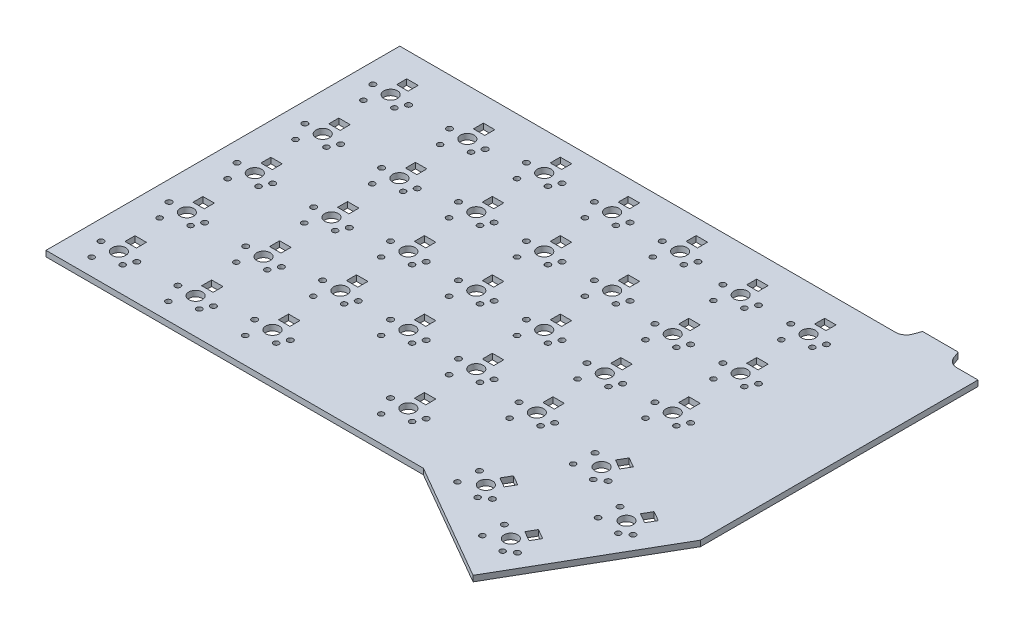
from build123d import *

# Parameters (mm, degrees)
SKETCH4_R           = 0.76
SKETCH4_R_2         = 1.9
SKETCH4_R_3         = 0.800000002
SKETCH4_R_4         = 0.8
SKETCH4_W           = 3.2
SKETCH4_H           = 2.8
BOSS_EXTRUDE1_DEPTH = 1.6
EXTRUDE_THIN1_START = -1.6
EXTRUDE_THIN1_DEPTH = 1.6


# Read off the part's stored shape, not the designer's step: Extrude-Thin1
with BuildPart() as part:
    # Sketch4 → Boss-Extrude1 (new body)
    with BuildSketch(Plane(origin=(0, 0, 0), x_dir=(1, 0, 0), z_dir=(0, 1, 0))):
        Polygon((162.15, -77.8), (162.15, 0), (0, 0), (0, -99.2), (105.815887282, -99.2), (138.8, -118.243386357), align=None)
        with Locations(Location((35.75, -15.759725685, 0), (0, 0, 270))):
            Circle(SKETCH4_R, mode=Mode.SUBTRACT)
        with Locations(Location((32.02, -13.07, 0), (0, 0, 270))):
            Circle(SKETCH4_R_2, mode=Mode.SUBTRACT)
        with Locations(Location((29.56, -18.25021243, 0), (0, 0, 270))):
            Circle(SKETCH4_R, mode=Mode.SUBTRACT)
        with Locations(Location((37.02, -13.07, 0), (0, 0, 270))):
            Circle(SKETCH4_R_3, mode=Mode.SUBTRACT)
        with Locations(Location((27.02, -13.07, 0), (0, 0, 270))):
            Circle(SKETCH4_R_4, mode=Mode.SUBTRACT)
        with Locations(Location((54.8, -13.251745606, 0), (0, 0, 270))):
            Circle(SKETCH4_R, mode=Mode.SUBTRACT)
        with Locations(Location((5.52, -13.07, 0), (0, 0, 270))):
            Circle(SKETCH4_R_4, mode=Mode.SUBTRACT)
        with Locations(Location((51.07, -10.562019921, 0), (0, 0, 270))):
            Circle(SKETCH4_R_2, mode=Mode.SUBTRACT)
        with Locations(Location((15.52, -13.07, 0), (0, 0, 270))):
            Circle(SKETCH4_R_3, mode=Mode.SUBTRACT)
        with Locations(Location((48.61, -15.742232351, 0), (0, 0, 270))):
            Circle(SKETCH4_R, mode=Mode.SUBTRACT)
        with Locations(Location((14.25, -15.759725685, 0), (0, 0, 270))):
            Circle(SKETCH4_R, mode=Mode.SUBTRACT)
        with Locations(Location((8.06, -18.25021243, 0), (0, 0, 270))):
            Circle(SKETCH4_R, mode=Mode.SUBTRACT)
        with Locations(Location((56.07, -10.562019921, 0), (0, 0, 270))):
            Circle(SKETCH4_R_3, mode=Mode.SUBTRACT)
        with Locations(Location((10.52, -13.07, 0), (0, 0, 270))):
            Circle(SKETCH4_R_2, mode=Mode.SUBTRACT)
        with Locations(Location((46.07, -10.562019921, 0), (0, 0, 270))):
            Circle(SKETCH4_R_4, mode=Mode.SUBTRACT)
        with Locations(Location((73.850000001, -13.251745606, 0), (0, 0, 270))):
            Circle(SKETCH4_R, mode=Mode.SUBTRACT)
        with Locations(Location((70.120000001, -10.562019921, 0), (0, 0, 270))):
            Circle(SKETCH4_R_2, mode=Mode.SUBTRACT)
        with Locations(Location((67.660000001, -15.742232351, 0), (0, 0, 270))):
            Circle(SKETCH4_R, mode=Mode.SUBTRACT)
        with Locations(Location((75.120000001, -10.562019921, 0), (0, 0, 270))):
            Circle(SKETCH4_R_3, mode=Mode.SUBTRACT)
        with Locations(Location((65.120000001, -10.562019921, 0), (0, 0, 270))):
            Circle(SKETCH4_R_4, mode=Mode.SUBTRACT)
        with Locations(Location((92.9, -13.251745606, 0), (0, 0, 270))):
            Circle(SKETCH4_R, mode=Mode.SUBTRACT)
        with Locations(Location((89.17, -10.562019921, 0), (0, 0, 270))):
            Circle(SKETCH4_R_2, mode=Mode.SUBTRACT)
        with Locations(Location((86.71, -15.742232351, 0), (0, 0, 270))):
            Circle(SKETCH4_R, mode=Mode.SUBTRACT)
        with Locations(Location((94.17, -10.562019921, 0), (0, 0, 270))):
            Circle(SKETCH4_R_3, mode=Mode.SUBTRACT)
        with Locations(Location((84.17, -10.562019921, 0), (0, 0, 270))):
            Circle(SKETCH4_R_4, mode=Mode.SUBTRACT)
        with Locations(Location((111.95, -15.321237867, 0), (0, 0, 270))):
            Circle(SKETCH4_R, mode=Mode.SUBTRACT)
        with Locations(Location((108.22, -12.631512182, 0), (0, 0, 270))):
            Circle(SKETCH4_R_2, mode=Mode.SUBTRACT)
        with Locations(Location((105.76, -17.811724612, 0), (0, 0, 270))):
            Circle(SKETCH4_R, mode=Mode.SUBTRACT)
        with Locations(Location((113.22, -12.631512182, 0), (0, 0, 270))):
            Circle(SKETCH4_R_3, mode=Mode.SUBTRACT)
        with Locations(Location((103.22, -12.631512182, 0), (0, 0, 270))):
            Circle(SKETCH4_R_4, mode=Mode.SUBTRACT)
        with Locations(Location((131, -15.321237867, 0), (0, 0, 270))):
            Circle(SKETCH4_R, mode=Mode.SUBTRACT)
        with Locations(Location((127.27, -12.631512182, 0), (0, 0, 270))):
            Circle(SKETCH4_R_2, mode=Mode.SUBTRACT)
        with Locations(Location((124.81, -17.811724612, 0), (0, 0, 270))):
            Circle(SKETCH4_R, mode=Mode.SUBTRACT)
        with Locations(Location((132.27, -12.631512182, 0), (0, 0, 270))):
            Circle(SKETCH4_R_3, mode=Mode.SUBTRACT)
        with Locations(Location((122.27, -12.631512182, 0), (0, 0, 270))):
            Circle(SKETCH4_R_4, mode=Mode.SUBTRACT)
        with Locations(Location((131, -34.371237867, 0), (0, 0, 270))):
            Circle(SKETCH4_R, mode=Mode.SUBTRACT)
        with Locations(Location((127.27, -31.681512182, 0), (0, 0, 270))):
            Circle(SKETCH4_R_2, mode=Mode.SUBTRACT)
        with Locations(Location((124.81, -36.861724612, 0), (0, 0, 270))):
            Circle(SKETCH4_R, mode=Mode.SUBTRACT)
        with Locations(Location((132.27, -31.681512182, 0), (0, 0, 270))):
            Circle(SKETCH4_R_3, mode=Mode.SUBTRACT)
        with Locations(Location((122.27, -31.681512182, 0), (0, 0, 270))):
            Circle(SKETCH4_R_4, mode=Mode.SUBTRACT)
        with Locations(Location((111.95, -34.371237867, 0), (0, 0, 270))):
            Circle(SKETCH4_R, mode=Mode.SUBTRACT)
        with Locations(Location((108.22, -31.681512182, 0), (0, 0, 270))):
            Circle(SKETCH4_R_2, mode=Mode.SUBTRACT)
        with Locations(Location((105.76, -36.861724612, 0), (0, 0, 270))):
            Circle(SKETCH4_R, mode=Mode.SUBTRACT)
        with Locations(Location((113.22, -31.681512182, 0), (0, 0, 270))):
            Circle(SKETCH4_R_3, mode=Mode.SUBTRACT)
        with Locations(Location((103.22, -31.681512182, 0), (0, 0, 270))):
            Circle(SKETCH4_R_4, mode=Mode.SUBTRACT)
        with Locations(Location((92.902083096, -32.301971902, 0), (0, 0, 270))):
            Circle(SKETCH4_R, mode=Mode.SUBTRACT)
        with Locations(Location((89.172083096, -29.612246218, 0), (0, 0, 270))):
            Circle(SKETCH4_R_2, mode=Mode.SUBTRACT)
        with Locations(Location((86.712083096, -34.792458648, 0), (0, 0, 270))):
            Circle(SKETCH4_R, mode=Mode.SUBTRACT)
        with Locations(Location((94.172083096, -29.612246218, 0), (0, 0, 270))):
            Circle(SKETCH4_R_3, mode=Mode.SUBTRACT)
        with Locations(Location((84.172083096, -29.612246218, 0), (0, 0, 270))):
            Circle(SKETCH4_R_4, mode=Mode.SUBTRACT)
        with Locations(Location((73.852083097, -32.301971902, 0), (0, 0, 270))):
            Circle(SKETCH4_R, mode=Mode.SUBTRACT)
        with Locations(Location((70.122083097, -29.612246218, 0), (0, 0, 270))):
            Circle(SKETCH4_R_2, mode=Mode.SUBTRACT)
        with Locations(Location((67.662083097, -34.792458648, 0), (0, 0, 270))):
            Circle(SKETCH4_R, mode=Mode.SUBTRACT)
        with Locations(Location((75.122083097, -29.612246218, 0), (0, 0, 270))):
            Circle(SKETCH4_R_3, mode=Mode.SUBTRACT)
        with Locations(Location((65.122083097, -29.612246218, 0), (0, 0, 270))):
            Circle(SKETCH4_R_4, mode=Mode.SUBTRACT)
        with Locations(Location((54.802083097, -32.301971902, 0), (0, 0, 270))):
            Circle(SKETCH4_R, mode=Mode.SUBTRACT)
        with Locations(Location((51.072083097, -29.612246218, 0), (0, 0, 270))):
            Circle(SKETCH4_R_2, mode=Mode.SUBTRACT)
        with Locations(Location((48.612083097, -34.792458648, 0), (0, 0, 270))):
            Circle(SKETCH4_R, mode=Mode.SUBTRACT)
        with Locations(Location((56.072083097, -29.612246218, 0), (0, 0, 270))):
            Circle(SKETCH4_R_3, mode=Mode.SUBTRACT)
        with Locations(Location((46.072083097, -29.612246218, 0), (0, 0, 270))):
            Circle(SKETCH4_R_4, mode=Mode.SUBTRACT)
        with Locations(Location((35.752083097, -34.809951982, 0), (0, 0, 270))):
            Circle(SKETCH4_R, mode=Mode.SUBTRACT)
        with Locations(Location((32.022083097, -32.120226297, 0), (0, 0, 270))):
            Circle(SKETCH4_R_2, mode=Mode.SUBTRACT)
        with Locations(Location((29.562083097, -37.300438727, 0), (0, 0, 270))):
            Circle(SKETCH4_R, mode=Mode.SUBTRACT)
        with Locations(Location((37.022083097, -32.120226297, 0), (0, 0, 270))):
            Circle(SKETCH4_R_3, mode=Mode.SUBTRACT)
        with Locations(Location((27.022083097, -32.120226297, 0), (0, 0, 270))):
            Circle(SKETCH4_R_4, mode=Mode.SUBTRACT)
        with Locations(Location((14.252083097, -34.809951982, 0), (0, 0, 270))):
            Circle(SKETCH4_R, mode=Mode.SUBTRACT)
        with Locations(Location((10.522083097, -32.120226297, 0), (0, 0, 270))):
            Circle(SKETCH4_R_2, mode=Mode.SUBTRACT)
        with Locations(Location((8.062083097, -37.300438727, 0), (0, 0, 270))):
            Circle(SKETCH4_R, mode=Mode.SUBTRACT)
        with Locations(Location((15.522083097, -32.120226297, 0), (0, 0, 270))):
            Circle(SKETCH4_R_3, mode=Mode.SUBTRACT)
        with Locations(Location((5.522083097, -32.120226297, 0), (0, 0, 270))):
            Circle(SKETCH4_R_4, mode=Mode.SUBTRACT)
        with Locations(Location((14.252083097, -53.859951982, 0), (0, 0, 270))):
            Circle(SKETCH4_R, mode=Mode.SUBTRACT)
        with Locations(Location((10.522083097, -51.170226297, 0), (0, 0, 270))):
            Circle(SKETCH4_R_2, mode=Mode.SUBTRACT)
        with Locations(Location((8.062083097, -56.350438727, 0), (0, 0, 270))):
            Circle(SKETCH4_R, mode=Mode.SUBTRACT)
        with Locations(Location((15.522083097, -51.170226297, 0), (0, 0, 270))):
            Circle(SKETCH4_R_3, mode=Mode.SUBTRACT)
        with Locations(Location((5.522083097, -51.170226297, 0), (0, 0, 270))):
            Circle(SKETCH4_R_4, mode=Mode.SUBTRACT)
        with Locations(Location((35.752083097, -53.859951982, 0), (0, 0, 270))):
            Circle(SKETCH4_R, mode=Mode.SUBTRACT)
        with Locations(Location((32.022083097, -51.170226297, 0), (0, 0, 270))):
            Circle(SKETCH4_R_2, mode=Mode.SUBTRACT)
        with Locations(Location((29.562083097, -56.350438727, 0), (0, 0, 270))):
            Circle(SKETCH4_R, mode=Mode.SUBTRACT)
        with Locations(Location((37.022083097, -51.170226297, 0), (0, 0, 270))):
            Circle(SKETCH4_R_3, mode=Mode.SUBTRACT)
        with Locations(Location((27.022083097, -51.170226297, 0), (0, 0, 270))):
            Circle(SKETCH4_R_4, mode=Mode.SUBTRACT)
        with Locations(Location((54.802083097, -51.351971902, 0), (0, 0, 270))):
            Circle(SKETCH4_R, mode=Mode.SUBTRACT)
        with Locations(Location((51.072083097, -48.662246218, 0), (0, 0, 270))):
            Circle(SKETCH4_R_2, mode=Mode.SUBTRACT)
        with Locations(Location((48.612083097, -53.842458648, 0), (0, 0, 270))):
            Circle(SKETCH4_R, mode=Mode.SUBTRACT)
        with Locations(Location((56.072083097, -48.662246218, 0), (0, 0, 270))):
            Circle(SKETCH4_R_3, mode=Mode.SUBTRACT)
        with Locations(Location((46.072083097, -48.662246218, 0), (0, 0, 270))):
            Circle(SKETCH4_R_4, mode=Mode.SUBTRACT)
        with Locations(Location((73.852083098, -51.351971902, 0), (0, 0, 270))):
            Circle(SKETCH4_R, mode=Mode.SUBTRACT)
        with Locations(Location((70.122083098, -48.662246218, 0), (0, 0, 270))):
            Circle(SKETCH4_R_2, mode=Mode.SUBTRACT)
        with Locations(Location((67.662083098, -53.842458648, 0), (0, 0, 270))):
            Circle(SKETCH4_R, mode=Mode.SUBTRACT)
        with Locations(Location((75.122083098, -48.662246218, 0), (0, 0, 270))):
            Circle(SKETCH4_R_3, mode=Mode.SUBTRACT)
        with Locations(Location((65.122083098, -48.662246218, 0), (0, 0, 270))):
            Circle(SKETCH4_R_4, mode=Mode.SUBTRACT)
        with Locations(Location((92.902083097, -51.351971902, 0), (0, 0, 270))):
            Circle(SKETCH4_R, mode=Mode.SUBTRACT)
        with Locations(Location((89.172083097, -48.662246218, 0), (0, 0, 270))):
            Circle(SKETCH4_R_2, mode=Mode.SUBTRACT)
        with Locations(Location((86.712083097, -53.842458648, 0), (0, 0, 270))):
            Circle(SKETCH4_R, mode=Mode.SUBTRACT)
        with Locations(Location((94.172083097, -48.662246218, 0), (0, 0, 270))):
            Circle(SKETCH4_R_3, mode=Mode.SUBTRACT)
        with Locations(Location((84.172083097, -48.662246218, 0), (0, 0, 270))):
            Circle(SKETCH4_R_4, mode=Mode.SUBTRACT)
        with Locations(Location((111.952083097, -53.421464163, 0), (0, 0, 270))):
            Circle(SKETCH4_R, mode=Mode.SUBTRACT)
        with Locations(Location((108.222083097, -50.731738479, 0), (0, 0, 270))):
            Circle(SKETCH4_R_2, mode=Mode.SUBTRACT)
        with Locations(Location((105.762083097, -55.911950909, 0), (0, 0, 270))):
            Circle(SKETCH4_R, mode=Mode.SUBTRACT)
        with Locations(Location((113.222083097, -50.731738479, 0), (0, 0, 270))):
            Circle(SKETCH4_R_3, mode=Mode.SUBTRACT)
        with Locations(Location((103.222083097, -50.731738479, 0), (0, 0, 270))):
            Circle(SKETCH4_R_4, mode=Mode.SUBTRACT)
        with Locations(Location((131.002083097, -53.421464163, 0), (0, 0, 270))):
            Circle(SKETCH4_R, mode=Mode.SUBTRACT)
        with Locations(Location((127.272083097, -50.731738479, 0), (0, 0, 270))):
            Circle(SKETCH4_R_2, mode=Mode.SUBTRACT)
        with Locations(Location((124.812083097, -55.911950909, 0), (0, 0, 270))):
            Circle(SKETCH4_R, mode=Mode.SUBTRACT)
        with Locations(Location((132.272083097, -50.731738479, 0), (0, 0, 270))):
            Circle(SKETCH4_R_3, mode=Mode.SUBTRACT)
        with Locations(Location((122.272083097, -50.731738479, 0), (0, 0, 270))):
            Circle(SKETCH4_R_4, mode=Mode.SUBTRACT)
        with Locations(Location((14.252083097, -72.909951982, 0), (0, 0, 270))):
            Circle(SKETCH4_R, mode=Mode.SUBTRACT)
        with Locations(Location((10.522083097, -70.220226297, 0), (0, 0, 270))):
            Circle(SKETCH4_R_2, mode=Mode.SUBTRACT)
        with Locations(Location((8.062083097, -75.400438727, 0), (0, 0, 270))):
            Circle(SKETCH4_R, mode=Mode.SUBTRACT)
        with Locations(Location((15.522083097, -70.220226297, 0), (0, 0, 270))):
            Circle(SKETCH4_R_3, mode=Mode.SUBTRACT)
        with Locations(Location((5.522083097, -70.220226297, 0), (0, 0, 270))):
            Circle(SKETCH4_R_4, mode=Mode.SUBTRACT)
        with Locations(Location((14.252083097, -91.959951982, 0), (0, 0, 270))):
            Circle(SKETCH4_R, mode=Mode.SUBTRACT)
        with Locations(Location((10.522083097, -89.270226297, 0), (0, 0, 270))):
            Circle(SKETCH4_R_2, mode=Mode.SUBTRACT)
        with Locations(Location((8.062083097, -94.450438727, 0), (0, 0, 270))):
            Circle(SKETCH4_R, mode=Mode.SUBTRACT)
        with Locations(Location((15.522083097, -89.270226297, 0), (0, 0, 270))):
            Circle(SKETCH4_R_3, mode=Mode.SUBTRACT)
        with Locations(Location((5.522083097, -89.270226297, 0), (0, 0, 270))):
            Circle(SKETCH4_R_4, mode=Mode.SUBTRACT)
        with Locations(Location((35.752083097, -91.959951982, 0), (0, 0, 270))):
            Circle(SKETCH4_R, mode=Mode.SUBTRACT)
        with Locations(Location((32.022083097, -89.270226297, 0), (0, 0, 270))):
            Circle(SKETCH4_R_2, mode=Mode.SUBTRACT)
        with Locations(Location((29.562083097, -94.450438727, 0), (0, 0, 270))):
            Circle(SKETCH4_R, mode=Mode.SUBTRACT)
        with Locations(Location((37.022083097, -89.270226297, 0), (0, 0, 270))):
            Circle(SKETCH4_R_3, mode=Mode.SUBTRACT)
        with Locations(Location((27.022083097, -89.270226297, 0), (0, 0, 270))):
            Circle(SKETCH4_R_4, mode=Mode.SUBTRACT)
        with Locations(Location((54.802083097, -89.451971902, 0), (0, 0, 270))):
            Circle(SKETCH4_R, mode=Mode.SUBTRACT)
        with Locations(Location((51.072083097, -86.762246218, 0), (0, 0, 270))):
            Circle(SKETCH4_R_2, mode=Mode.SUBTRACT)
        with Locations(Location((48.612083097, -91.942458648, 0), (0, 0, 270))):
            Circle(SKETCH4_R, mode=Mode.SUBTRACT)
        with Locations(Location((56.072083097, -86.762246218, 0), (0, 0, 270))):
            Circle(SKETCH4_R_3, mode=Mode.SUBTRACT)
        with Locations(Location((46.072083097, -86.762246218, 0), (0, 0, 270))):
            Circle(SKETCH4_R_4, mode=Mode.SUBTRACT)
        with Locations(Location((92.902083097, -89.451971902, 0), (0, 0, 270))):
            Circle(SKETCH4_R, mode=Mode.SUBTRACT)
        with Locations(Location((89.172083097, -86.762246218, 0), (0, 0, 270))):
            Circle(SKETCH4_R_2, mode=Mode.SUBTRACT)
        with Locations(Location((86.712083097, -91.942458648, 0), (0, 0, 270))):
            Circle(SKETCH4_R, mode=Mode.SUBTRACT)
        with Locations(Location((94.172083097, -86.762246218, 0), (0, 0, 270))):
            Circle(SKETCH4_R_3, mode=Mode.SUBTRACT)
        with Locations(Location((84.172083097, -86.762246218, 0), (0, 0, 270))):
            Circle(SKETCH4_R_4, mode=Mode.SUBTRACT)
        with Locations(Location((92.902083097, -70.401971902, 0), (0, 0, 270))):
            Circle(SKETCH4_R, mode=Mode.SUBTRACT)
        with Locations(Location((89.172083097, -67.712246218, 0), (0, 0, 270))):
            Circle(SKETCH4_R_2, mode=Mode.SUBTRACT)
        with Locations(Location((86.712083097, -72.892458648, 0), (0, 0, 270))):
            Circle(SKETCH4_R, mode=Mode.SUBTRACT)
        with Locations(Location((94.172083097, -67.712246218, 0), (0, 0, 270))):
            Circle(SKETCH4_R_3, mode=Mode.SUBTRACT)
        with Locations(Location((84.172083097, -67.712246218, 0), (0, 0, 270))):
            Circle(SKETCH4_R_4, mode=Mode.SUBTRACT)
        with Locations(Location((73.852083098, -70.401971902, 0), (0, 0, 270))):
            Circle(SKETCH4_R, mode=Mode.SUBTRACT)
        with Locations(Location((70.122083098, -67.712246218, 0), (0, 0, 270))):
            Circle(SKETCH4_R_2, mode=Mode.SUBTRACT)
        with Locations(Location((67.662083098, -72.892458648, 0), (0, 0, 270))):
            Circle(SKETCH4_R, mode=Mode.SUBTRACT)
        with Locations(Location((75.122083098, -67.712246218, 0), (0, 0, 270))):
            Circle(SKETCH4_R_3, mode=Mode.SUBTRACT)
        with Locations(Location((65.122083098, -67.712246218, 0), (0, 0, 270))):
            Circle(SKETCH4_R_4, mode=Mode.SUBTRACT)
        with Locations(Location((54.802083097, -70.401971902, 0), (0, 0, 270))):
            Circle(SKETCH4_R, mode=Mode.SUBTRACT)
        with Locations(Location((51.072083097, -67.712246218, 0), (0, 0, 270))):
            Circle(SKETCH4_R_2, mode=Mode.SUBTRACT)
        with Locations(Location((48.612083097, -72.892458648, 0), (0, 0, 270))):
            Circle(SKETCH4_R, mode=Mode.SUBTRACT)
        with Locations(Location((56.072083097, -67.712246218, 0), (0, 0, 270))):
            Circle(SKETCH4_R_3, mode=Mode.SUBTRACT)
        with Locations(Location((46.072083097, -67.712246218, 0), (0, 0, 270))):
            Circle(SKETCH4_R_4, mode=Mode.SUBTRACT)
        with Locations(Location((35.752083097, -72.909951982, 0), (0, 0, 270))):
            Circle(SKETCH4_R, mode=Mode.SUBTRACT)
        with Locations(Location((32.022083097, -70.220226297, 0), (0, 0, 270))):
            Circle(SKETCH4_R_2, mode=Mode.SUBTRACT)
        with Locations(Location((29.562083097, -75.400438727, 0), (0, 0, 270))):
            Circle(SKETCH4_R, mode=Mode.SUBTRACT)
        with Locations(Location((37.022083097, -70.220226297, 0), (0, 0, 270))):
            Circle(SKETCH4_R_3, mode=Mode.SUBTRACT)
        with Locations(Location((27.022083097, -70.220226297, 0), (0, 0, 270))):
            Circle(SKETCH4_R_4, mode=Mode.SUBTRACT)
        with Locations(Location((111.952083097, -72.471464163, 0), (0, 0, 270))):
            Circle(SKETCH4_R, mode=Mode.SUBTRACT)
        with Locations(Location((108.222083097, -69.781738479, 0), (0, 0, 270))):
            Circle(SKETCH4_R_2, mode=Mode.SUBTRACT)
        with Locations(Location((105.762083097, -74.961950909, 0), (0, 0, 270))):
            Circle(SKETCH4_R, mode=Mode.SUBTRACT)
        with Locations(Location((113.222083097, -69.781738479, 0), (0, 0, 270))):
            Circle(SKETCH4_R_3, mode=Mode.SUBTRACT)
        with Locations(Location((103.222083097, -69.781738479, 0), (0, 0, 270))):
            Circle(SKETCH4_R_4, mode=Mode.SUBTRACT)
        with Locations(Location((113.917042474, -97.744400248, 0), (0, 0, 270))):
            Circle(SKETCH4_R, mode=Mode.SUBTRACT)
        with Locations(Location((120.522983096, -98.682575459, 0), (0, 0, 270))):
            Circle(SKETCH4_R, mode=Mode.SUBTRACT)
        with Locations(Location((122.967698201, -96.988204687, 0), (0, 0, 270))):
            Circle(SKETCH4_R_3, mode=Mode.SUBTRACT)
        with Locations(Location((114.307444163, -91.988204687, 0), (0, 0, 270))):
            Circle(SKETCH4_R_4, mode=Mode.SUBTRACT)
        with Locations(Location((118.637571182, -94.488204687, 0), (0, 0, 270))):
            Circle(SKETCH4_R_2, mode=Mode.SUBTRACT)
        with Locations(Location((125.781554389, -77.17533282, 0), (0, 0, 270))):
            Circle(SKETCH4_R, mode=Mode.SUBTRACT)
        with Locations(Location((132.387495011, -78.113508031, 0), (0, 0, 270))):
            Circle(SKETCH4_R, mode=Mode.SUBTRACT)
        with Locations(Location((134.832210116, -76.419137258, 0), (0, 0, 270))):
            Circle(SKETCH4_R_3, mode=Mode.SUBTRACT)
        with Locations(Location((126.171956078, -71.419137258, 0), (0, 0, 270))):
            Circle(SKETCH4_R_4, mode=Mode.SUBTRACT)
        with Locations(Location((130.502083097, -73.919137258, 0), (0, 0, 270))):
            Circle(SKETCH4_R_2, mode=Mode.SUBTRACT)
        with Locations(Location((142.33240876, -86.723271481, 0), (0, 0, 270))):
            Circle(SKETCH4_R, mode=Mode.SUBTRACT)
        with Locations(Location((148.938349382, -87.661446692, 0), (0, 0, 270))):
            Circle(SKETCH4_R, mode=Mode.SUBTRACT)
        with Locations(Location((151.383064488, -85.967075919, 0), (0, 0, 270))):
            Circle(SKETCH4_R_3, mode=Mode.SUBTRACT)
        with Locations(Location((142.72281045, -80.967075919, 0), (0, 0, 270))):
            Circle(SKETCH4_R_4, mode=Mode.SUBTRACT)
        with Locations(Location((147.052937469, -83.467075919, 0), (0, 0, 270))):
            Circle(SKETCH4_R_2, mode=Mode.SUBTRACT)
        with Locations(Location((130.467896845, -107.292116575, 0), (0, 0, 270))):
            Circle(SKETCH4_R, mode=Mode.SUBTRACT)
        with Locations(Location((137.073837467, -108.230291786, 0), (0, 0, 270))):
            Circle(SKETCH4_R, mode=Mode.SUBTRACT)
        with Locations(Location((139.518552573, -106.535921013, 0), (0, 0, 270))):
            Circle(SKETCH4_R_3, mode=Mode.SUBTRACT)
        with Locations(Location((130.858298535, -101.535921013, 0), (0, 0, 270))):
            Circle(SKETCH4_R_4, mode=Mode.SUBTRACT)
        with Locations(Location((135.188425554, -104.035921013, 0), (0, 0, 270))):
            Circle(SKETCH4_R_2, mode=Mode.SUBTRACT)
        with Locations((10.52, -8.37)):
            Rectangle(SKETCH4_W, SKETCH4_H, mode=Mode.SUBTRACT)
        with Locations((32.02, -8.37)):
            Rectangle(SKETCH4_W, SKETCH4_H, mode=Mode.SUBTRACT)
        with Locations((51.07, -5.862019921)):
            Rectangle(SKETCH4_W, SKETCH4_H, mode=Mode.SUBTRACT)
        with Locations((70.120000001, -5.862019921)):
            Rectangle(SKETCH4_W, SKETCH4_H, mode=Mode.SUBTRACT)
        with Locations((89.17, -5.862019921)):
            Rectangle(SKETCH4_W, SKETCH4_H, mode=Mode.SUBTRACT)
        with Locations((108.22, -7.931512182)):
            Rectangle(SKETCH4_W, SKETCH4_H, mode=Mode.SUBTRACT)
        with Locations((127.27, -7.931512182)):
            Rectangle(SKETCH4_W, SKETCH4_H, mode=Mode.SUBTRACT)
        with Locations((127.27, -26.981512182)):
            Rectangle(SKETCH4_W, SKETCH4_H, mode=Mode.SUBTRACT)
        with Locations((108.22, -26.981512182)):
            Rectangle(SKETCH4_W, SKETCH4_H, mode=Mode.SUBTRACT)
        with Locations((89.172083096, -24.912246218)):
            Rectangle(SKETCH4_W, SKETCH4_H, mode=Mode.SUBTRACT)
        with Locations((70.122083097, -24.912246218)):
            Rectangle(SKETCH4_W, SKETCH4_H, mode=Mode.SUBTRACT)
        with Locations((51.072083097, -24.912246218)):
            Rectangle(SKETCH4_W, SKETCH4_H, mode=Mode.SUBTRACT)
        with Locations((32.022083097, -27.420226297)):
            Rectangle(SKETCH4_W, SKETCH4_H, mode=Mode.SUBTRACT)
        with Locations((10.522083097, -27.420226297)):
            Rectangle(SKETCH4_W, SKETCH4_H, mode=Mode.SUBTRACT)
        with Locations((10.522083097, -46.470226297)):
            Rectangle(SKETCH4_W, SKETCH4_H, mode=Mode.SUBTRACT)
        with Locations((32.022083097, -46.470226297)):
            Rectangle(SKETCH4_W, SKETCH4_H, mode=Mode.SUBTRACT)
        with Locations((51.072083097, -43.962246218)):
            Rectangle(SKETCH4_W, SKETCH4_H, mode=Mode.SUBTRACT)
        with Locations((70.122083098, -43.962246218)):
            Rectangle(SKETCH4_W, SKETCH4_H, mode=Mode.SUBTRACT)
        with Locations((89.172083097, -43.962246218)):
            Rectangle(SKETCH4_W, SKETCH4_H, mode=Mode.SUBTRACT)
        with Locations((108.222083097, -46.031738479)):
            Rectangle(SKETCH4_W, SKETCH4_H, mode=Mode.SUBTRACT)
        with Locations((127.272083097, -46.031738479)):
            Rectangle(SKETCH4_W, SKETCH4_H, mode=Mode.SUBTRACT)
        with Locations((10.522083097, -65.520226297)):
            Rectangle(SKETCH4_W, SKETCH4_H, mode=Mode.SUBTRACT)
        with Locations((32.022083097, -65.520226297)):
            Rectangle(SKETCH4_W, SKETCH4_H, mode=Mode.SUBTRACT)
        with Locations((32.022083097, -84.570226297)):
            Rectangle(SKETCH4_W, SKETCH4_H, mode=Mode.SUBTRACT)
        with Locations((10.522083097, -84.570226297)):
            Rectangle(SKETCH4_W, SKETCH4_H, mode=Mode.SUBTRACT)
        with Locations((51.072083097, -82.062246218)):
            Rectangle(SKETCH4_W, SKETCH4_H, mode=Mode.SUBTRACT)
        with Locations((51.072083097, -63.012246218)):
            Rectangle(SKETCH4_W, SKETCH4_H, mode=Mode.SUBTRACT)
        with Locations((70.122083098, -63.012246218)):
            Rectangle(SKETCH4_W, SKETCH4_H, mode=Mode.SUBTRACT)
        with Locations((89.172083097, -63.012246218)):
            Rectangle(SKETCH4_W, SKETCH4_H, mode=Mode.SUBTRACT)
        with Locations((89.172083097, -82.062246218)):
            Rectangle(SKETCH4_W, SKETCH4_H, mode=Mode.SUBTRACT)
        with Locations((108.222083097, -65.081738479)):
            Rectangle(SKETCH4_W, SKETCH4_H, mode=Mode.SUBTRACT)
        Polygon((132.166442451, -67.836382295), (134.937723743, -69.436382295), (133.537723743, -71.861253426), (130.766442451, -70.261253426), align=None, mode=Mode.SUBTRACT)
        Polygon((120.301930536, -88.405449724), (123.073211828, -90.005449724), (121.673211828, -92.430320855), (118.901930536, -90.830320855), align=None, mode=Mode.SUBTRACT)
        Polygon((148.717296823, -77.384320956), (151.488578115, -78.984320956), (150.088578115, -81.409192087), (147.317296823, -79.809192087), align=None, mode=Mode.SUBTRACT)
        Polygon((136.852784908, -97.95316605), (139.6240662, -99.55316605), (138.2240662, -101.978037181), (135.452784908, -100.378037181), align=None, mode=Mode.SUBTRACT)
    extrude(amount=BOSS_EXTRUDE1_DEPTH)

    # Extrude-Thin1 outline → Extrude-Thin1 (add)
    with BuildSketch(Plane(origin=(0, 1.6, 0), x_dir=(1, 0, 0), z_dir=(0, 1, 0)).offset(EXTRUDE_THIN1_START)):
        with BuildLine():
            ThreePointArc((141.857195284, 1.960963251), (140.757938397, 0.538586763), (139.042874294, 0))
            Line((139.042874294, 0), (156.177125708, 0))
            ThreePointArc((156.177125708, 0), (154.462061605, 0.538586763), (153.362804718, 1.960963251))
            Line((153.362804718, 1.960963251), (152.610000001, 4))
            Line((152.610000001, 4), (142.610000001, 4))
            Line((142.610000001, 4), (141.857195284, 1.960963251))
        make_face()
    extrude(amount=EXTRUDE_THIN1_DEPTH)


solid = part.part
